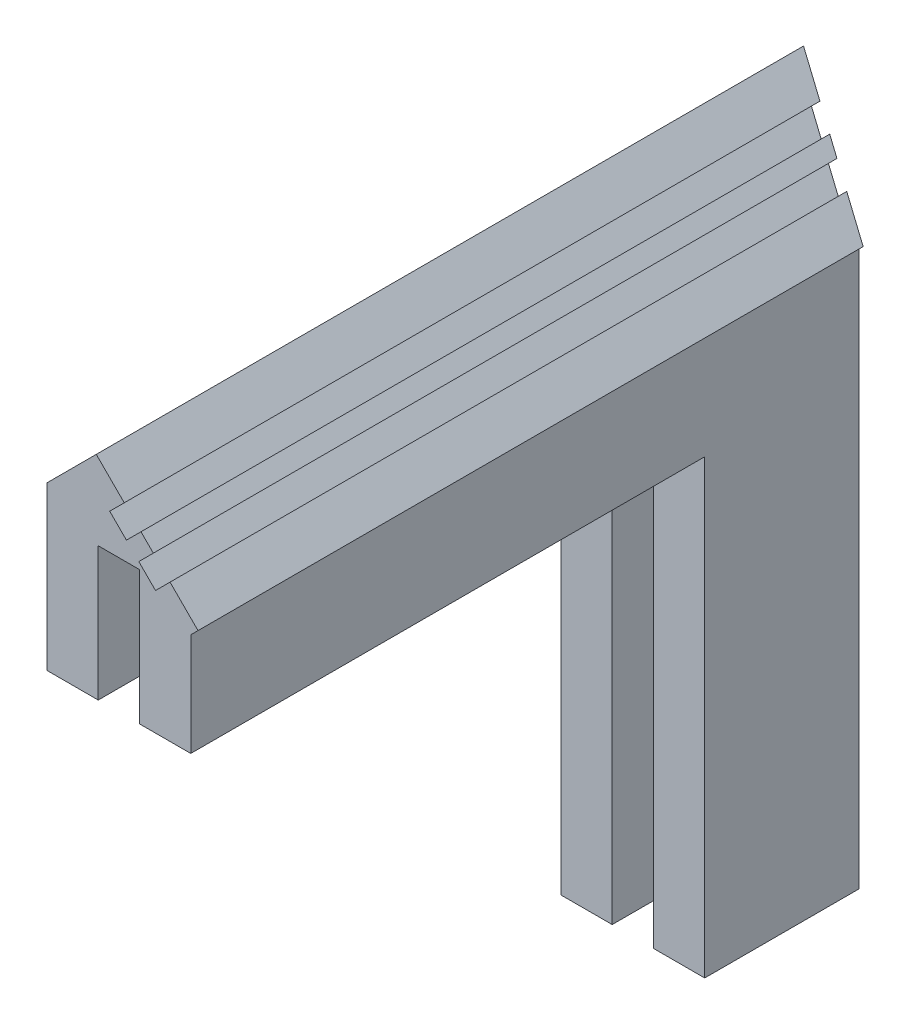
from build123d import *

# Parameters (mm, degrees)
BOSS_EXTRUDE2_START       = -53.9167663
BOSS_EXTRUDE2_DEPTH       = 53.9167663
BOSS_EXTRUDE2_START_2     = -5.234980118
BOSS_EXTRUDE2_2_DEPTH     = 20.234980118
BOSS_EXTRUDE2_START_3     = -5.798989873
BOSS_EXTRUDE2_3_DEPTH     = 2.136888219
BOSS_EXTRUDE2_4_OUTLINE_W = 4
BOSS_EXTRUDE2_4_OUTLINE_H = 13
BOSS_EXTRUDE2_4_DEPTH     = 15
BOSS_EXTRUDE3_DEPTH       = 13
BOSS_EXTRUDE4_DEPTH       = 50
CUT_EXTRUDE2_DEPTH        = 91.086151296
BOSS_EXTRUDE12_REACH      = 92.086
CUT_EXTRUDE6_REACH        = 92.086


with BuildPart() as part:
    # Boss-Extrude2: read off the stored shape, not the designer's step
    # Boss-Extrude2 outline → Boss-Extrude2 (new body)
    with BuildSketch(Plane(origin=(0, 0, 0), x_dir=(1, 0, 0), z_dir=(0, 1, 0)).offset(BOSS_EXTRUDE2_START)):
        Polygon((0, -15), (0, 0), (-14, 5.798989873), (-14, -15), (-9, -15), (-9, -2), (-5, -2), (-5, -15), align=None)
    extrude(amount=BOSS_EXTRUDE2_DEPTH)



with BuildPart() as body_2:
    # Boss-Extrude2 2 outline → Boss-Extrude2 2 (new body)
    with BuildSketch(Plane.XY.offset(BOSS_EXTRUDE2_START_2)):
        Polygon((-14, 0), (0, 0), (-14, 14), align=None)
    extrude(amount=BOSS_EXTRUDE2_2_DEPTH)


with BuildPart() as part_1:
    add(part.part)

    add(body_2.part)  # Boss-Extrude2 3 merges body 2
    # Boss-Extrude2 3 outline → Boss-Extrude2 3 (add)
    with BuildSketch(Plane.XY.offset(BOSS_EXTRUDE2_START_3)):
        Polygon((-14, 0), (-9, 0), (-9, 9), (-14, 14), align=None)
    extrude(amount=BOSS_EXTRUDE2_3_DEPTH)

    # Boss-Extrude2 4 outline → Boss-Extrude2 4 (cut)
    with BuildSketch(Plane(origin=(0, 0, 0), x_dir=(1, 0, 0), z_dir=(0, 1, 0))):
        Polygon((0, 5.234980118), (-9, 5.234980118), (-9, 5.798989873), (-14, 5.798989873), (0, 0), align=None)
        with Locations((-7, -8.5)):
            Rectangle(BOSS_EXTRUDE2_4_OUTLINE_W, BOSS_EXTRUDE2_4_OUTLINE_H)
    extrude(amount=BOSS_EXTRUDE2_4_DEPTH, mode=Mode.SUBTRACT)

    # Sketch4 → Boss-Extrude3 (add)
    with BuildSketch(Plane.XY.offset(2)):
        Polygon((-5, 5), (-5, 3), (-9, 3), (-9, 9), align=None)
    extrude(amount=BOSS_EXTRUDE3_DEPTH)

    # Sketch5 → Boss-Extrude4 (add)
    with BuildSketch(Plane.XY.offset(15)):
        Polygon((-9, -10), (-9, 3), (-5, 3), (-5, -10), (0, -10), (0, 0), (-14, 14), (-14, -10), align=None)
    extrude(amount=BOSS_EXTRUDE4_DEPTH)

    # Sketch11 → Cut-Extrude2 (cut, through all)
    with BuildSketch(Plane.XY.offset(65)):
        Polygon((-9.899494937, 9.899494937), (-14, 5.798989873), (-14, 14), align=None)
    extrude(amount=-CUT_EXTRUDE2_DEPTH, mode=Mode.SUBTRACT)

    # Boss-Extrude12: up to this plane
    boss_extrude12_end = Plane(origin=(0, -53.9167663, 0), z_dir=(0.38268343236508406, 0, -0.9238795325112893))
    # Sketch21 → Boss-Extrude12 (add, up to the surface)
    with BuildSketch(Plane.XY.offset(65), mode=Mode.PRIVATE) as boss_extrude12_sk1:
        Polygon((-9.899494937, 9.899494937), (-9.192388155, 10.606601718), (0.707106781, 0.707106781), (0, 0), align=None)
    boss_extrude12_tool1 = split(extrude(boss_extrude12_sk1.sketch, amount=-BOSS_EXTRUDE12_REACH, mode=Mode.PRIVATE), bisect_by=boss_extrude12_end, keep=Keep.BOTH, mode=Mode.PRIVATE)
    add(boss_extrude12_tool1.solids().sort_by_distance((-4.596194, 5.303301, 65))[0])

    # Cut-Extrude6: up to this plane
    cut_extrude6_end = Plane(origin=(0, -53.9167663, 0), z_dir=(0.38268343236508406, 0, -0.9238795325112893))
    # Sketch22 → Cut-Extrude6 (cut, up to the surface)
    with BuildSketch(Plane.XY.offset(65), mode=Mode.PRIVATE) as cut_extrude6_sk1:
        Polygon((-3.429467889, 2.015254326), (-2.015254326, 3.429467889), (-3.641599923, 5.055813485), (-5.055813485, 3.641599923), align=None)
    cut_extrude6_tool1 = split(extrude(cut_extrude6_sk1.sketch, amount=-CUT_EXTRUDE6_REACH, mode=Mode.PRIVATE), bisect_by=cut_extrude6_end, keep=Keep.BOTH, mode=Mode.PRIVATE)
    add(cut_extrude6_tool1.solids().sort_by_distance((-3.535534, 3.535534, 65))[0], mode=Mode.SUBTRACT)
    # Sketch22 → Cut-Extrude6 (cut, up to the surface)
    with BuildSketch(Plane.XY.offset(65), mode=Mode.PRIVATE) as cut_extrude6_sk2:
        Polygon((-6.257895014, 4.843681451), (-4.843681451, 6.257895014), (-6.470027048, 7.88424061), (-7.88424061, 6.470027048), align=None)
    cut_extrude6_tool2 = split(extrude(cut_extrude6_sk2.sketch, amount=-CUT_EXTRUDE6_REACH, mode=Mode.PRIVATE), bisect_by=cut_extrude6_end, keep=Keep.BOTH, mode=Mode.PRIVATE)
    add(cut_extrude6_tool2.solids().sort_by_distance((-6.363961, 6.363961, 65))[0], mode=Mode.SUBTRACT)


solid = part_1.part
